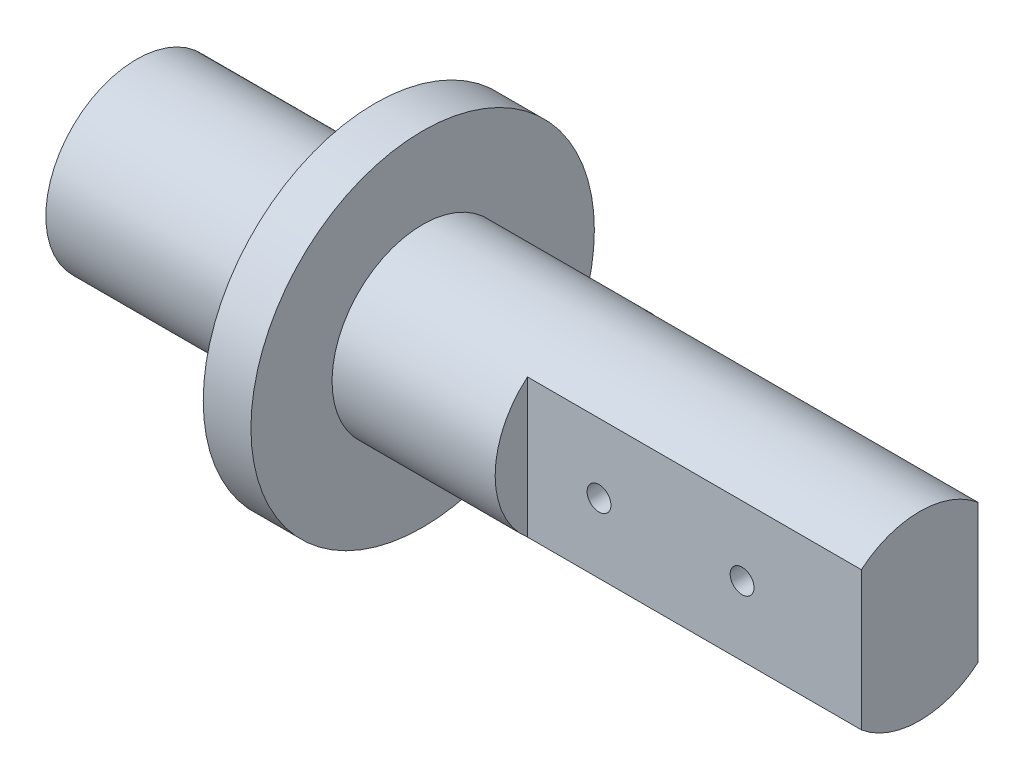
from build123d import *
from build123d.topology import SkipClean

# Parameters (mm, degrees)
SKETCH1_W                           = 47.1
SKETCH1_H                           = 10
BOSS_EXTRUDE1_START                 = 30
BOSS_EXTRUDE1_DEPTH                 = 30
BOSS_EXTRUDE2_START                 = -17.1
SKETCH8_R                           = 18
BOSS_EXTRUDE2_DEPTH                 = 5
M3X0_5_TAPPED_HOLE3_D               = 2.5
M3X0_5_TAPPED_HOLE3_DEPTH           = 10
M3X0_5_TAPPED_HOLE3_TIP             = 0.751075774
M3X0_5_TAPPED_HOLE2_D               = 2.5
M3X0_5_TAPPED_HOLE2_DEPTH           = 5
M3X0_5_TAPPED_HOLE2_TIP             = 0.751075774
M3X0_5_TAPPED_HOLE2_ON_FACE_2_D     = 2.5
M3X0_5_TAPPED_HOLE2_ON_FACE_2_DEPTH = 5
M3X0_5_TAPPED_HOLE2_ON_FACE_2_TIP   = 0.751075774
BOSS_EXTRUDE3_START                 = 5
BOSS_EXTRUDE3_DEPTH                 = 5
TOLERANCING_START                   = 30
TOLERANCING_OUTLINE_R               = 10
TOLERANCING_OUTLINE_R_2             = 9.5
TOLERANCING_DEPTH                   = 52.1
TOLERANCING_2_OUTLINE_R             = 10
TOLERANCING_2_OUTLINE_R_2           = 9.5
TOLERANCING_2_DEPTH                 = 25
TOLERANCING_START_2                 = 47.1
TOLERANCING_3_DEPTH                 = 35


# Read off the part's stored shape, not the designer's step: Tolerancing
with BuildPart() as part:
    # Sketch1 → Revolve1 (revolve)
    with BuildSketch(Plane.XY, mode=Mode.PRIVATE) as revolve1_sk:
        with Locations((23.55, 5)):
            Rectangle(SKETCH1_W, SKETCH1_H)
    revolve(revolve1_sk.sketch.rotate(Axis((0, 0, 0), (1, 0, 0)), 90), axis=Axis((0, 0, 0), (1, 0, 0)))

    # Sketch3 → Boss-Extrude1 (add)
    with BuildSketch(Plane(origin=(47.1, 0, 0), x_dir=(0, 0, -1), z_dir=(1, 0, 0)).offset(BOSS_EXTRUDE1_START)):
        with BuildLine():
            Line((-6.614378278, -7.5), (-6.614378278, 7.5))
            ThreePointArc((-6.614378278, 7.5), (0, 10), (6.614378278, 7.5))
            Line((6.614378278, 7.5), (6.614378278, -7.5))
            ThreePointArc((6.614378278, -7.5), (0, -10), (-6.614378278, -7.5))
        make_face()
    extrude(amount=-BOSS_EXTRUDE1_DEPTH)

    # Sketch8 → Boss-Extrude2 (add)
    with BuildSketch(Plane(origin=(47.1, 0, 0), x_dir=(0, 0, -1), z_dir=(1, 0, 0)).offset(BOSS_EXTRUDE2_START)):
        Circle(SKETCH8_R)
    extrude(amount=-BOSS_EXTRUDE2_DEPTH)

    # M3x0.5 Tapped Hole3
    with Locations(Plane.XY.offset(10)):
        with Locations((20, 0)):
            Hole(M3X0_5_TAPPED_HOLE3_D / 2, depth=M3X0_5_TAPPED_HOLE3_DEPTH)
            with Locations((0, 0, -(M3X0_5_TAPPED_HOLE3_DEPTH + M3X0_5_TAPPED_HOLE3_TIP / 2))):  # 118° drill point
                Cone(0, M3X0_5_TAPPED_HOLE3_D / 2, M3X0_5_TAPPED_HOLE3_TIP, mode=Mode.SUBTRACT)

    # M3x0.5 Tapped Hole2
    with Locations(Plane(origin=(54.6, 0, 6.614378278), x_dir=(1, 0, 0), z_dir=(0, 0, 1))):
        with Locations((0, 0), (15, 0)):
            Hole(M3X0_5_TAPPED_HOLE2_D / 2, depth=M3X0_5_TAPPED_HOLE2_DEPTH)
            with Locations((0, 0, -(M3X0_5_TAPPED_HOLE2_DEPTH + M3X0_5_TAPPED_HOLE2_TIP / 2))):  # 118° drill point
                Cone(0, M3X0_5_TAPPED_HOLE2_D / 2, M3X0_5_TAPPED_HOLE2_TIP, mode=Mode.SUBTRACT)

    # M3x0.5 Tapped Hole2 on face 2
    with Locations(Plane(origin=(69.6, 0, -6.614378278), x_dir=(-1, 0, 0), z_dir=(0, 0, -1))):
        with Locations((0, 0), (15, 0)):
            Hole(M3X0_5_TAPPED_HOLE2_ON_FACE_2_D / 2, depth=M3X0_5_TAPPED_HOLE2_ON_FACE_2_DEPTH)
            with Locations((0, 0, -(M3X0_5_TAPPED_HOLE2_ON_FACE_2_DEPTH + M3X0_5_TAPPED_HOLE2_ON_FACE_2_TIP / 2))):  # 118° drill point
                Cone(0, M3X0_5_TAPPED_HOLE2_ON_FACE_2_D / 2, M3X0_5_TAPPED_HOLE2_ON_FACE_2_TIP, mode=Mode.SUBTRACT)

    # Sketch9 → Boss-Extrude3 (add)
    with SkipClean():  # the faces are left unmerged after this step: merging them gives an invalid solid
        with BuildSketch(Plane(origin=(77.1, 0, 0), x_dir=(0, 0, -1), z_dir=(1, 0, 0)).offset(BOSS_EXTRUDE3_START)):
            with BuildLine():
                Line((6.614378278, -7.5), (6.614378278, 7.5))
                ThreePointArc((6.614378278, 7.5), (0, 10), (-6.614378278, 7.5))
                Line((-6.614378278, 7.5), (-6.614378278, -7.5))
                ThreePointArc((-6.614378278, -7.5), (0, -10), (6.614378278, -7.5))
            make_face()
        extrude(amount=-BOSS_EXTRUDE3_DEPTH)

    # Tolerancing outline → Tolerancing (cut)
    with BuildSketch(Plane.YZ.offset(TOLERANCING_START)):
        Circle(TOLERANCING_OUTLINE_R)
        Circle(TOLERANCING_OUTLINE_R_2, mode=Mode.SUBTRACT)
    extrude(amount=TOLERANCING_DEPTH, mode=Mode.SUBTRACT)

    # Tolerancing 2 outline → Tolerancing 2 (cut)
    with BuildSketch(Plane.YZ):
        Circle(TOLERANCING_2_OUTLINE_R)
        Circle(TOLERANCING_2_OUTLINE_R_2, mode=Mode.SUBTRACT)
    extrude(amount=TOLERANCING_2_DEPTH, mode=Mode.SUBTRACT)

    # Tolerancing 3 outline → Tolerancing 3 (cut)
    with BuildSketch(Plane.YZ.offset(TOLERANCING_START_2)):
        with BuildLine():
            Line((-7.270789385, 6.114378278), (7.270789385, 6.114378278))
            ThreePointArc((7.270789385, 6.114378278), (7.049374529, 6.368384313), (6.819090848, 6.614378278))
            Line((6.819090848, 6.614378278), (-6.819090848, 6.614378278))
            ThreePointArc((-6.819090848, 6.614378278), (-7.049374529, 6.368384313), (-7.270789385, 6.114378278))
        make_face()
        with BuildLine():
            ThreePointArc((6.819090848, -6.614378278), (7.049374529, -6.368384313), (7.270789385, -6.114378278))
            Line((7.270789385, -6.114378278), (-7.270789385, -6.114378278))
            ThreePointArc((-7.270789385, -6.114378278), (-7.049374529, -6.368384313), (-6.819090848, -6.614378278))
            Line((-6.819090848, -6.614378278), (6.819090848, -6.614378278))
        make_face()
    extrude(amount=TOLERANCING_3_DEPTH, mode=Mode.SUBTRACT)


solid = part.part
